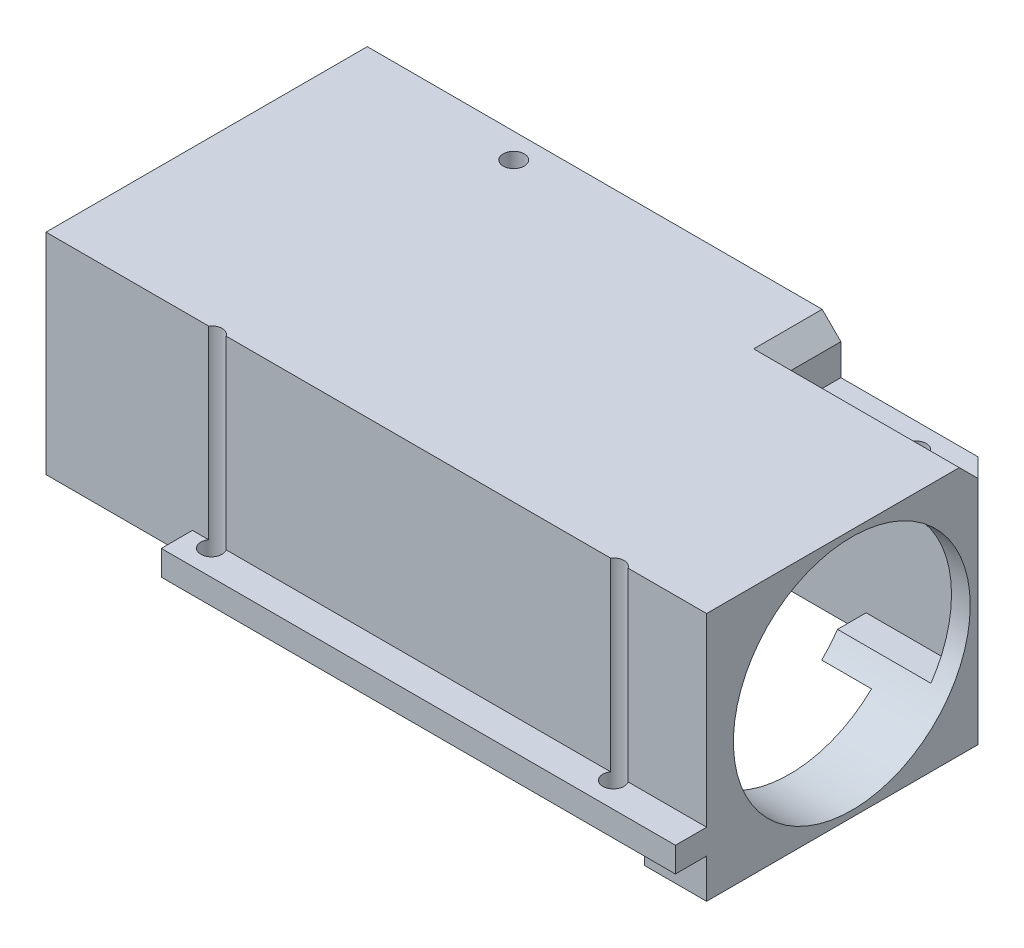
from build123d import *

# Parameters (mm, degrees)
BOSS_EXTRUDE1_DEPTH            = 46.6
CUT_EXTRUDE1_REACH             = 124.505
SKETCH2_R                      = 19
SKETCH3_W                      = 3
SKETCH3_H                      = 28.7
BOSS_EXTRUDE2_DEPTH            = 103
SKETCH4_W                      = 5
SKETCH4_H                      = 4
BOSS_EXTRUDE3_DEPTH            = 82.5
SKETCH6_W                      = 3
SKETCH6_H                      = 33.7
BOSS_EXTRUDE4_DEPTH            = 106
SKETCH8_W                      = 4.95
SKETCH8_H                      = 33.7
BOSS_EXTRUDE5_DEPTH            = 106
CHAMFER2_SIZE                  = 8
M3_CLEARANCE_HOLE1_D           = 3.4
M3_CLEARANCE_HOLE1_ON_FACE_2_D = 3.4
CHAMFER3_SIZE                  = 6
SKETCH12_W                     = 8
SKETCH12_H                     = 8
CUT_EXTRUDE4_DEPTH             = 30
CHAMFER4_SIZE                  = 3


with BuildPart() as part:
    # Sketch1 → Boss-Extrude1 (new body)
    with BuildSketch(Plane.XY):
        Polygon((0, 0), (0, 40), (-106, 40), (-106, 35), (-3, 35), (-3, 9.3), (-18, 9.3), (-18, 6.3), (-10, 6.3), (-10, 0), align=None)
    extrude(amount=BOSS_EXTRUDE1_DEPTH)

    # Sketch2 → Cut-Extrude1 (cut, up to next)
    with BuildSketch(Plane(origin=(0, 0, 0), x_dir=(0, 0, -1), z_dir=(1, 0, 0)), mode=Mode.PRIVATE) as cut_extrude1_sk1:
        with Locations((-23.3, 20)):
            Circle(SKETCH2_R)
    cut_extrude1_tool1 = extrude(cut_extrude1_sk1.sketch, amount=-CUT_EXTRUDE1_REACH, mode=Mode.PRIVATE) & part.part
    add(cut_extrude1_tool1.solids().sort_by_distance((0, 20, 23.3))[0], mode=Mode.SUBTRACT)

    # Sketch3 → Boss-Extrude2 (add)
    with BuildSketch(Plane.ZY.offset(3)):
        with Locations((45.1, 20.65)):
            Rectangle(SKETCH3_W, SKETCH3_H)
    extrude(amount=BOSS_EXTRUDE2_DEPTH)

    # Sketch4 → Boss-Extrude3 (add)
    with BuildSketch(Plane(origin=(0, 0, 0), x_dir=(0, 0, -1), z_dir=(1, 0, 0))):
        with Locations((-49.1, 8.3)):
            Rectangle(SKETCH4_W, SKETCH4_H)
    extrude(amount=-BOSS_EXTRUDE3_DEPTH)

    # Sketch6 → Boss-Extrude4 (add)
    with BuildSketch(Plane(origin=(0, 0, 0), x_dir=(0, 0, -1), z_dir=(1, 0, 0))):
        with Locations((-1.5, 23.15)):
            Rectangle(SKETCH6_W, SKETCH6_H)
    extrude(amount=-BOSS_EXTRUDE4_DEPTH)

    # Sketch8 → Boss-Extrude5 (add)
    with BuildSketch(Plane(origin=(0, 0, 0), x_dir=(0, 0, -1), z_dir=(1, 0, 0))):
        with Locations((2.475, 23.15)):
            Rectangle(SKETCH8_W, SKETCH8_H)
    extrude(amount=-BOSS_EXTRUDE5_DEPTH)

    # Chamfer2
    chamfer2_edges = [part.edges().sort_by_distance(p)[0] for p in [
        (0, 23.15, -4.95),
    ]]
    chamfer(chamfer2_edges, length=CHAMFER2_SIZE)

    # M3 Clearance Hole1 (through all)
    with Locations(Plane(origin=(-14, 0, -0.95), x_dir=(0, 0, -1), z_dir=(0, -1, 0))):
        with Locations((0, 0), (-48.5, 0), (-48.5, -64.5)):
            Hole(M3_CLEARANCE_HOLE1_D / 2)

    # M3 Clearance Hole1 on face 2 (through all)
    with Locations(Plane(origin=(-78.5, -3, -0.95), x_dir=(0, 0, -1), z_dir=(0, -1, 0))):
        with Locations((0, 0)):
            Hole(M3_CLEARANCE_HOLE1_ON_FACE_2_D / 2)

    # Chamfer3
    chamfer3_edges = [part.edges().sort_by_distance(p)[0] for p in [
        (-54.5, 35, 43.6),
        (-54.5, 35, 3),
    ]]
    chamfer(chamfer3_edges, length=CHAMFER3_SIZE)

    # Sketch12 → Cut-Extrude4 (cut)
    with BuildSketch(Plane(origin=(0, 0, 0), x_dir=(0, 0, -1), z_dir=(1, 0, 0))):
        with Locations((0.95, 36)):
            Rectangle(SKETCH12_W, SKETCH12_H)
    extrude(amount=-CUT_EXTRUDE4_DEPTH, mode=Mode.SUBTRACT)

    # Chamfer4
    chamfer4_edges = [part.edges().sort_by_distance(p)[0] for p in [
        (-30, 40, -0.95),
        (-15, 40, 3.05),
    ]]
    chamfer(chamfer4_edges, length=CHAMFER4_SIZE)


solid = part.part
